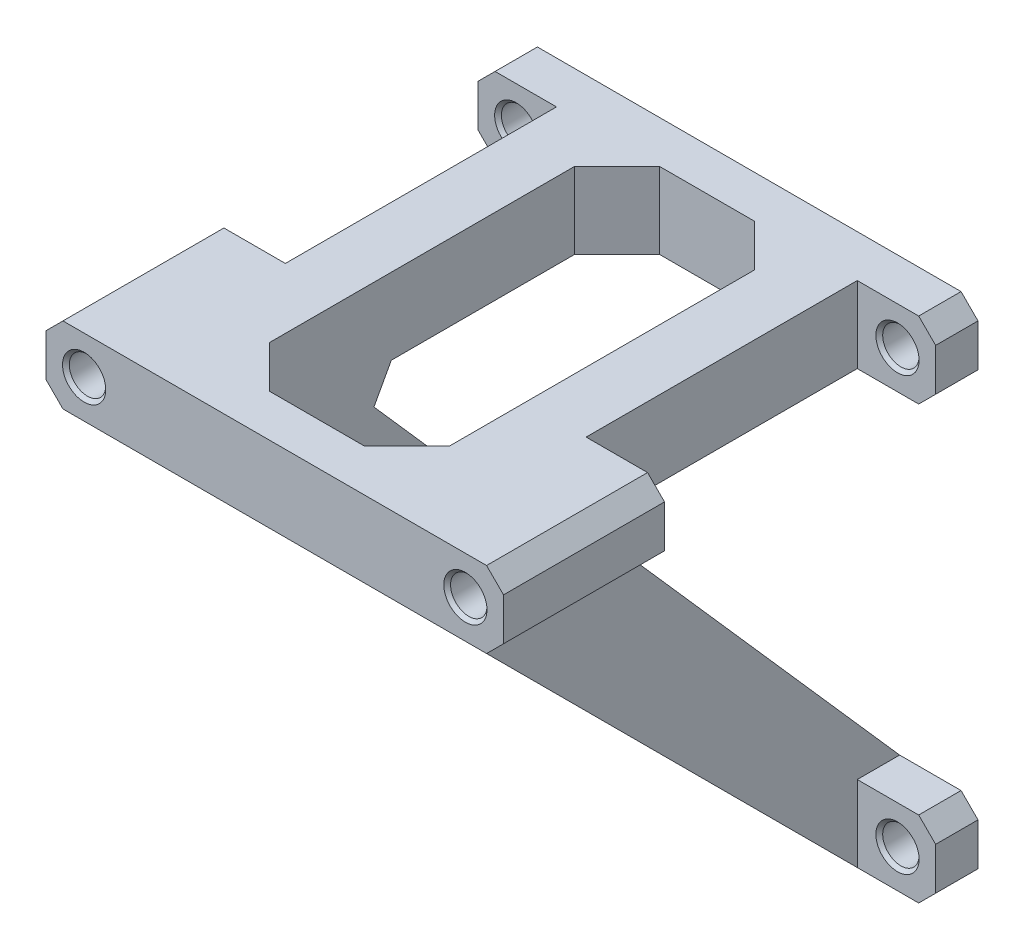
from build123d import *

# Parameters (mm, degrees)
SKETCH1_W               = 54
SKETCH1_H               = 60
BOSS_EXTRUDE1_DEPTH     = 5
BOSS_EXTRUDE2_DEPTH     = 54
SKETCH6_W               = 9.25
SKETCH6_H               = 32
CUT_EXTRUDE1_DEPTH      = 99.244592727
SKETCH8_W               = 9.25
SKETCH8_H               = 42
CUT_EXTRUDE3_DEPTH      = 99.244592727
M4_CLEARANCE_HOLE2_D    = 4.3
CUT_EXTRUDE4_DEPTH      = 94.480278669
SKETCH12_W              = 21.2
SKETCH12_H              = 46
CUT_EXTRUDE5_DEPTH      = 99.244592727
CHAMFER1_SIZE           = 2
CHAMFER2_SIZE           = 5
CHAMFER2_SIZE_2         = 5.352523158
SKETCH13_W              = 21.2
SKETCH13_H              = 5
CUT_EXTRUDE6_DEPTH      = 99.244592727
CHAMFER3_SIZE           = 5
BOSS_EXTRUDE3_DEPTH     = 19
CUT_EXTRUDE7_DEPTH      = 94.480278669
CUT_EXTRUDE7_DEPTH_BACK = 94.480278669
CHAMFER4_SIZE           = 0.4
CHAMFER5_SIZE           = 0.4


with BuildPart() as part:
    # Sketch1 → Boss-Extrude1 (new body)
    with BuildSketch(Plane.XY):
        with Locations((27, 30)):
            Rectangle(SKETCH1_W, SKETCH1_H)
    extrude(amount=BOSS_EXTRUDE1_DEPTH)

    # Sketch5 → Boss-Extrude2 (add)
    with BuildSketch(Plane.ZY):
        Polygon((56, 60), (5, 60), (5, 0), (56, 51), align=None)
    extrude(amount=-BOSS_EXTRUDE2_DEPTH)

    # Sketch6 → Cut-Extrude1 (cut, through all)
    with BuildSketch(Plane(origin=(0, 60, 0), x_dir=(1, 0, 0), z_dir=(0, 1, 0))):
        with Locations((4.625, -21)):
            Rectangle(SKETCH6_W, SKETCH6_H)
    cut_extrude1 = extrude(amount=-CUT_EXTRUDE1_DEPTH, mode=Mode.SUBTRACT)

    # Sketch8 → Cut-Extrude3 (cut, through all)
    with BuildSketch(Plane(origin=(0, 0, 0), x_dir=(-1, 0, 0), z_dir=(0, 0, -1))):
        with Locations((-4.625, 30)):
            Rectangle(SKETCH8_W, SKETCH8_H)
    cut_extrude3 = extrude(amount=-CUT_EXTRUDE3_DEPTH, mode=Mode.SUBTRACT)

    # Mirror1: Cut-Extrude1, Cut-Extrude3 across plane
    add(cut_extrude1.mirror(Plane(origin=(27, 0, 0), x_dir=(0, 0, 1), z_dir=(1, 0, 0))), mode=Mode.SUBTRACT)
    add(cut_extrude3.mirror(Plane(origin=(27, 0, 0), x_dir=(0, 0, 1), z_dir=(1, 0, 0))), mode=Mode.SUBTRACT)

    # M4 Clearance Hole2 (through all)
    with Locations(Plane(origin=(0, 0, 0), x_dir=(-1, 0, 0), z_dir=(0, 0, -1))):
        with Locations((-4.5, 55.5), (-49.5, 55.5), (-49.5, 4.5), (-4.5, 4.5)):
            Hole(M4_CLEARANCE_HOLE2_D / 2)

    # Sketch11 → Cut-Extrude4 (cut, through all)
    with BuildSketch(Plane.ZY.offset(-9.25)):
        Polygon((0, 9), (37, 51), (0, 51), align=None)
    extrude(amount=-CUT_EXTRUDE4_DEPTH, mode=Mode.SUBTRACT)

    # Sketch12 → Cut-Extrude5 (cut, through all)
    with BuildSketch(Plane(origin=(0, 60, 0), x_dir=(1, 0, 0), z_dir=(0, 1, 0))):
        with Locations((27, -28)):
            Rectangle(SKETCH12_W, SKETCH12_H)
    extrude(amount=-CUT_EXTRUDE5_DEPTH, mode=Mode.SUBTRACT)

    # Chamfer1
    chamfer1_edges = [part.edges().sort_by_distance(p)[0] for p in [
        (0, 60, 2.5),
        (0, 9, 2.5),
        (0, 51, 2.5),
        (0, 51, 46.5),
        (54, 60, 2.5),
        (0, 60, 46.5),
        (54, 60, 46.5),
        (54, 0, 2.5),
        (0, 0, 2.5),
        (54, 51, 46.5),
        (54, 9, 2.5),
        (54, 51, 2.5),
    ]]
    chamfer(chamfer1_edges, length=CHAMFER1_SIZE)

    # Chamfer2
    # the kernel refuses this chamfer: 5.352523158, 5 mm, written as the material it adds along each edge
    with BuildSketch(Plane(origin=(37.6, 51, 37), x_dir=(0, -0.7759635654606418, -0.6307777303278932), z_dir=(1, 0, 0)), Plane(origin=(9.25, 51, 37), x_dir=(0, -0.7759635654606418, -0.6307777303278932), z_dir=(1, 0, 0))) as chamfer2_piece_1:
        Polygon((CHAMFER2_SIZE * 0.999214586642, CHAMFER2_SIZE * 0.039625873385), (CHAMFER2_SIZE_2 * 0.630777730356, CHAMFER2_SIZE_2 * 0.775963565495), (0, 0), align=None)
    extrude(amount=7.15)

    # Sketch13 → Cut-Extrude6 (cut, through all)
    with BuildSketch(Plane(origin=(0, 0, 0), x_dir=(-1, 0, 0), z_dir=(0, 0, -1))):
        with Locations((-27, 48.5)):
            Rectangle(SKETCH13_W, SKETCH13_H)
    extrude(amount=-CUT_EXTRUDE6_DEPTH, mode=Mode.SUBTRACT)

    # Chamfer3
    chamfer3_edges = [part.edges().sort_by_distance(p)[0] for p in [
        (16.4, 55.5, 5),
        (16.4, 7.337837838, 5),
        (37.6, 7.337837838, 5),
        (37.6, 55.5, 5),
        (16.4, 55.5, 51),
        (37.6, 55.5, 51),
    ]]
    chamfer(chamfer3_edges, length=CHAMFER3_SIZE)

    # Sketch14 → Boss-Extrude3 (add)
    with BuildSketch(Plane(origin=(0, 0, 37), x_dir=(-1, 0, 0), z_dir=(0, 0, -1))):
        Polygon((-2, 51), (-9.25, 43.75), (-9.25, 51), align=None)
    boss_extrude3 = extrude(amount=-BOSS_EXTRUDE3_DEPTH)

    # Mirror3: Boss-Extrude3 across plane
    add(boss_extrude3.mirror(Plane(origin=(27, 0, 0), x_dir=(0, 0, 1), z_dir=(1, 0, 0))))

    # Sketch15 → Cut-Extrude7 (cut, two sides: drawn at the far end of the back side and taken through both)
    with BuildSketch(Plane(origin=(9.25, 0, 0), x_dir=(0, 0, -1), z_dir=(1, 0, 0)).offset(-CUT_EXTRUDE7_DEPTH_BACK)):
        Polygon((-48.75, 43.75), (-56, 51), (-56, 43.75), align=None)
    extrude(amount=CUT_EXTRUDE7_DEPTH + CUT_EXTRUDE7_DEPTH_BACK, mode=Mode.SUBTRACT)

    # Chamfer4
    chamfer4_edges = [part.edges().sort_by_distance(p)[0] for p in [
        (47.35, 55.5, 37),
        (47.35, 55.5, 56),
        (2.35, 55.5, 56),
        (2.35, 55.5, 37),
    ]]
    chamfer(chamfer4_edges, length=CHAMFER4_SIZE)

    # Chamfer5
    chamfer5_edges = [part.edges().sort_by_distance(p)[0] for p in [
        (2.35, 4.5, 5),
        (2.35, 4.5, 0),
        (47.35, 4.5, 5),
        (47.35, 4.5, 0),
        (47.35, 55.5, 5),
        (47.35, 55.5, 0),
        (2.35, 55.5, 5),
        (2.35, 55.5, 0),
    ]]
    chamfer(chamfer5_edges, length=CHAMFER5_SIZE)


solid = part.part
